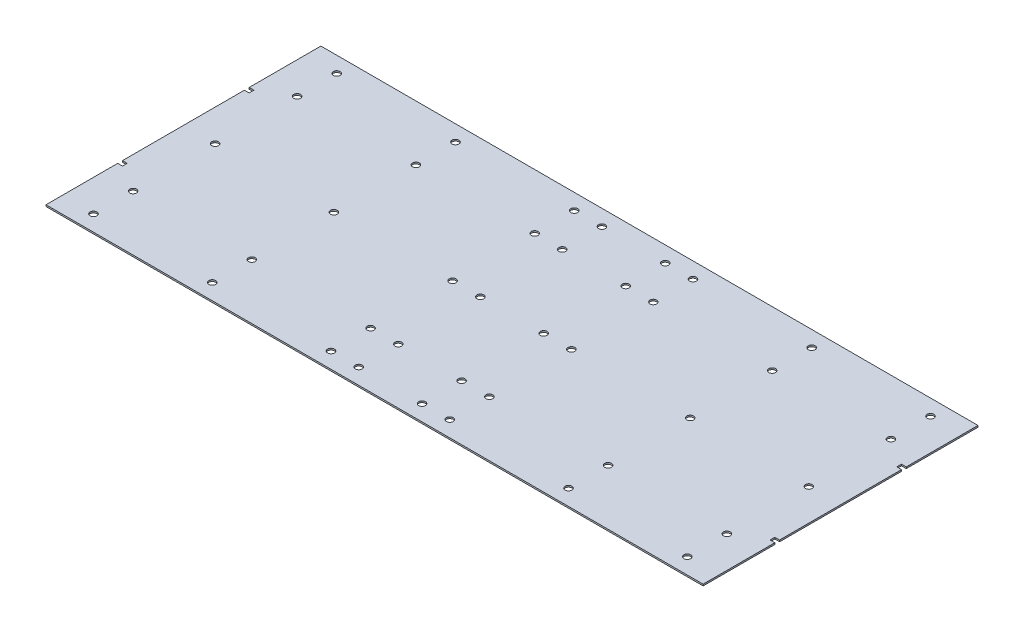
from build123d import *

# Parameters (mm, degrees)
SKETCH1_R           = 2.15
BOSS_EXTRUDE1_DEPTH = 1


with BuildPart() as part:
    # Sketch1 → Boss-Extrude1 (new body)
    with BuildSketch(Plane(origin=(0, 0, 0), x_dir=(1, 0, 0), z_dir=(0, 1, 0))):
        Polygon((-17, -41.5), (-20, -41.5), (-20, -86.8), (395, -86.8), (395, -41.5), (392, -41.5), (392, -38.5), (395, -38.5), (395, 38.5), (392, 38.5), (392, 41.5), (395, 41.5), (395, 86.8), (-20, 86.8), (-20, 41.5), (-17, 41.5), (-17, 38.5), (-20, 38.5), (-20, -38.5), (-17, -38.5), align=None)
        with Locations((0, -76.8)):
            Circle(SKETCH1_R, mode=Mode.SUBTRACT)
        with Locations((75, -76.8)):
            Circle(SKETCH1_R, mode=Mode.SUBTRACT)
        with Locations((0, -51.8)):
            Circle(SKETCH1_R, mode=Mode.SUBTRACT)
        with Locations((75, -51.8)):
            Circle(SKETCH1_R, mode=Mode.SUBTRACT)
        with Locations((150, -76.8)):
            Circle(SKETCH1_R, mode=Mode.SUBTRACT)
        with Locations((167.5, -76.8)):
            Circle(SKETCH1_R, mode=Mode.SUBTRACT)
        with Locations((150, -51.8)):
            Circle(SKETCH1_R, mode=Mode.SUBTRACT)
        with Locations((167.5, -51.8)):
            Circle(SKETCH1_R, mode=Mode.SUBTRACT)
        Circle(SKETCH1_R, mode=Mode.SUBTRACT)
        with Locations((75, 0)):
            Circle(SKETCH1_R, mode=Mode.SUBTRACT)
        with Locations((150, 0)):
            Circle(SKETCH1_R, mode=Mode.SUBTRACT)
        with Locations((167.5, 0)):
            Circle(SKETCH1_R, mode=Mode.SUBTRACT)
        with Locations((207.5, -76.8)):
            Circle(SKETCH1_R, mode=Mode.SUBTRACT)
        with Locations((225, -76.8)):
            Circle(SKETCH1_R, mode=Mode.SUBTRACT)
        with Locations((207.5, -51.8)):
            Circle(SKETCH1_R, mode=Mode.SUBTRACT)
        with Locations((225, -51.8)):
            Circle(SKETCH1_R, mode=Mode.SUBTRACT)
        with Locations((300, -76.8)):
            Circle(SKETCH1_R, mode=Mode.SUBTRACT)
        with Locations((375, -76.8)):
            Circle(SKETCH1_R, mode=Mode.SUBTRACT)
        with Locations((300, -51.8)):
            Circle(SKETCH1_R, mode=Mode.SUBTRACT)
        with Locations((375, -51.8)):
            Circle(SKETCH1_R, mode=Mode.SUBTRACT)
        with Locations((207.5, 0)):
            Circle(SKETCH1_R, mode=Mode.SUBTRACT)
        with Locations((225, 0)):
            Circle(SKETCH1_R, mode=Mode.SUBTRACT)
        with Locations((300, 0)):
            Circle(SKETCH1_R, mode=Mode.SUBTRACT)
        with Locations((375, 0)):
            Circle(SKETCH1_R, mode=Mode.SUBTRACT)
        with Locations((0, 51.8)):
            Circle(SKETCH1_R, mode=Mode.SUBTRACT)
        with Locations((75, 51.8)):
            Circle(SKETCH1_R, mode=Mode.SUBTRACT)
        with Locations((0, 76.8)):
            Circle(SKETCH1_R, mode=Mode.SUBTRACT)
        with Locations((75, 76.8)):
            Circle(SKETCH1_R, mode=Mode.SUBTRACT)
        with Locations((150, 51.8)):
            Circle(SKETCH1_R, mode=Mode.SUBTRACT)
        with Locations((167.5, 51.8)):
            Circle(SKETCH1_R, mode=Mode.SUBTRACT)
        with Locations((150, 76.8)):
            Circle(SKETCH1_R, mode=Mode.SUBTRACT)
        with Locations((167.5, 76.8)):
            Circle(SKETCH1_R, mode=Mode.SUBTRACT)
        with Locations((207.5, 51.8)):
            Circle(SKETCH1_R, mode=Mode.SUBTRACT)
        with Locations((225, 51.8)):
            Circle(SKETCH1_R, mode=Mode.SUBTRACT)
        with Locations((207.5, 76.8)):
            Circle(SKETCH1_R, mode=Mode.SUBTRACT)
        with Locations((225, 76.8)):
            Circle(SKETCH1_R, mode=Mode.SUBTRACT)
        with Locations((300, 51.8)):
            Circle(SKETCH1_R, mode=Mode.SUBTRACT)
        with Locations((375, 51.8)):
            Circle(SKETCH1_R, mode=Mode.SUBTRACT)
        with Locations((300, 76.8)):
            Circle(SKETCH1_R, mode=Mode.SUBTRACT)
        with Locations((375, 76.8)):
            Circle(SKETCH1_R, mode=Mode.SUBTRACT)
    extrude(amount=BOSS_EXTRUDE1_DEPTH)


solid = part.part
